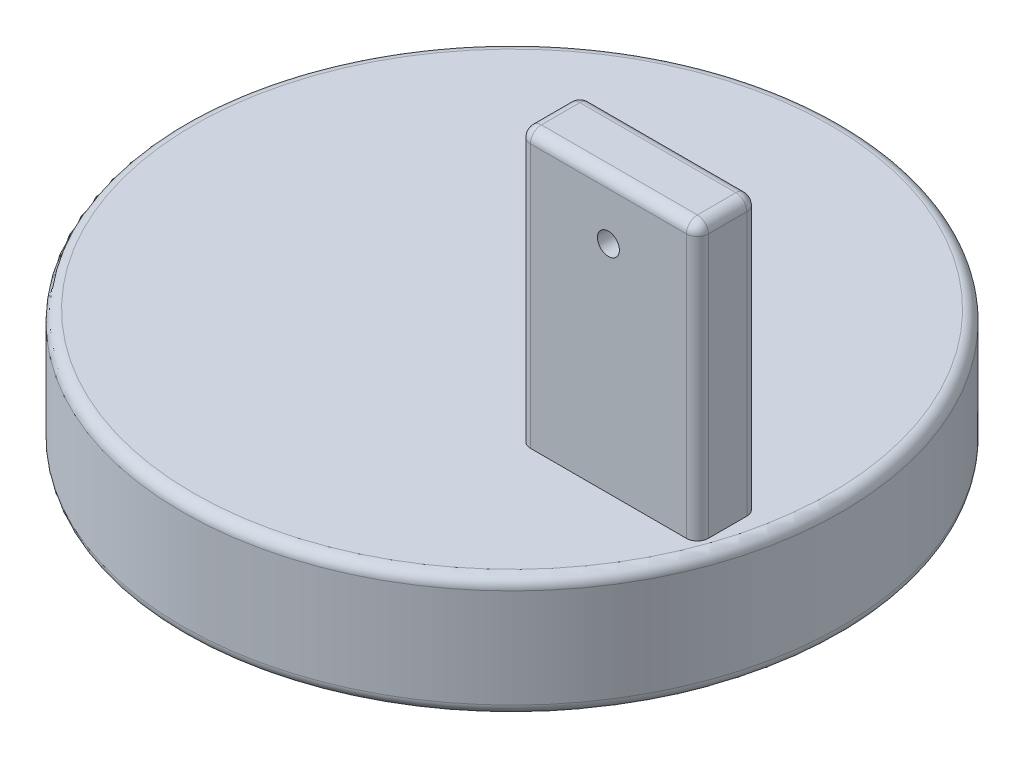
from build123d import *

# Parameters (mm, degrees)
SKETCH_2_R      = 30
EXTRUDE_1_DEPTH = 11
SKETCH_3_W      = 16.2
SKETCH_3_H      = 25
SKETCH_3_R      = 1
EXTRUDE_2_DEPTH = 5.5
FILLET_1_R      = 1


with BuildPart() as part:
    # 草图2 → 凸台-拉伸1 (new body)
    with BuildSketch(Plane(origin=(0, 0, 0), x_dir=(1, 0, 0), z_dir=(0, 1, 0))):
        Circle(SKETCH_2_R)
    extrude(amount=EXTRUDE_1_DEPTH)

    # 草图3 → 凸台-拉伸2 (add)
    with BuildSketch(Plane.XY.offset(4.63)):
        with Locations((18.9, 23.5)):
            Rectangle(SKETCH_3_W, SKETCH_3_H)
        with Locations((18.9, 30.67)):
            Circle(SKETCH_3_R, mode=Mode.SUBTRACT)
    extrude(amount=EXTRUDE_2_DEPTH)

    # 圆角1
    fillet_1_edges = [part.edges().sort_by_distance(p)[0] for p in [
        (10.8, 23.5, 4.63),
        (27, 23.5, 4.63),
        (10.8, 23.5, 10.13),
        (27, 23.5, 10.13),
        (18.9, 36, 4.63),
        (18.9, 36, 10.13),
        (10.8, 36, 7.38),
        (27, 36, 7.38),
        (-30, 0, 0),
        (-30, 11, 0),
    ]]
    fillet(fillet_1_edges, radius=FILLET_1_R)


solid = part.part
